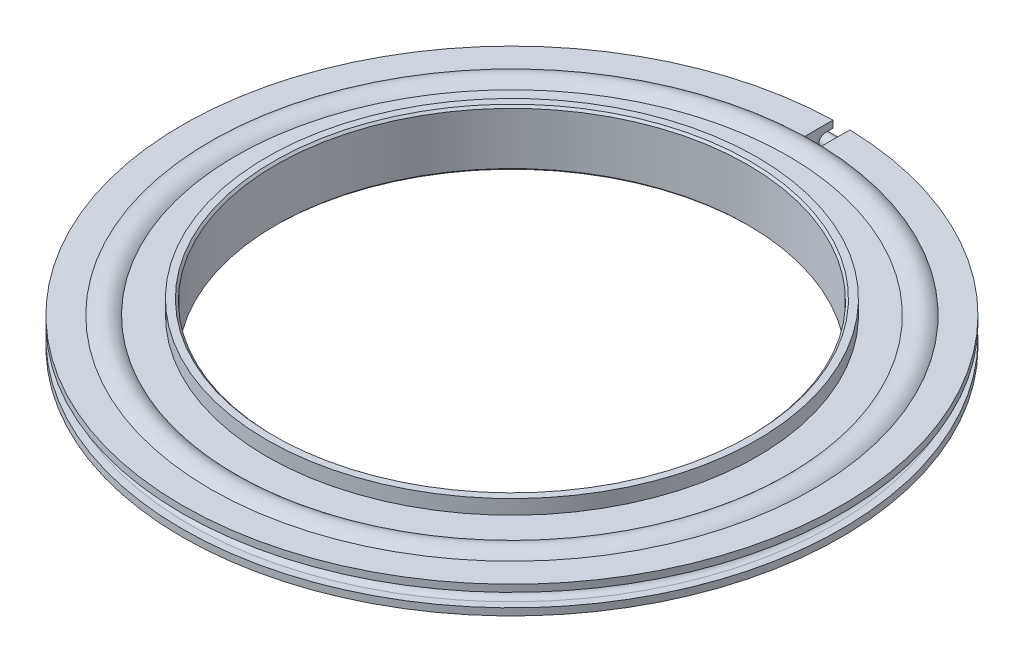
from build123d import *

# Parameters (mm, degrees)
SKETCH5_R                = 2.65
CUT_THICKEN1_START       = -1.2
CUT_THICKEN1_2_OUTLINE_W = 3.9
CUT_THICKEN1_2_OUTLINE_H = 7
CUT_THICKEN1_2_DEPTH     = 2.4
SKETCH12_R               = 0.9
SKETCH12_R_2             = 0.7
REVOLVE4_ANGLE           = 28


with BuildPart() as part:
    # Sketch5 → Revolve2 (revolve)
    with BuildSketch(Plane(origin=(0, 0, 0), x_dir=(-1, 0, 0), z_dir=(0, 0, -1)), mode=Mode.PRIVATE) as revolve2_sk:
        with Locations((-41, 0)):
            Circle(SKETCH5_R)
    revolve(revolve2_sk.sketch.rotate(Axis((0, -2.65, 0), (0, 1, 0)), 270), axis=Axis((0, -2.65, 0), (0, 1, 0)))


with BuildPart() as body_2:
    # Sketch7 → Revolve3 (revolve)
    with BuildSketch(Plane.XY, mode=Mode.PRIVATE) as revolve3_sk:
        with BuildLine():
            Line((34.8, 4), (33.8, 4))
            Line((33.8, 4), (33.5, 3.7))
            Line((33.5, 3.7), (33.5, -3.7))
            Line((33.5, -3.7), (33.8, -4))
            Line((33.8, -4), (34.8, -4))
            Line((34.8, -4), (34.8, -1.95))
            Line((34.8, -1.95), (39.205564156, -1.95))
            ThreePointArc((39.205564156, -1.95), (38.35, 0), (39.205564156, 1.95))
            Line((39.205564156, 1.95), (34.8, 1.95))
            Line((34.8, 1.95), (34.8, 4))
        make_face()
    revolve(revolve3_sk.sketch.rotate(Axis((0, 4, 0), (0, -1, 0)), 270), axis=Axis((0, 4, 0), (0, -1, 0)))


with BuildPart() as body_3:
    # Cut-Thicken1: read off the stored shape, not the designer's step
    # Cut-Thicken1 outline → Cut-Thicken1 (revolve)
    with BuildSketch(Plane.XY):
        with BuildLine():
            Line((42.794435844, -1.95), (46.8, -1.95))
            Line((46.8, -1.95), (46.8, -0.95))
            Line((46.8, -0.95), (45.75, -0.95))
            ThreePointArc((45.75, -0.95), (44.8, 0), (45.75, 0.95))
            Line((45.75, 0.95), (46.8, 0.95))
            Line((46.8, 0.95), (46.8, 1.95))
            Line((46.8, 1.95), (42.794435844, 1.95))
            ThreePointArc((42.794435844, 1.95), (43.65, 0), (42.794435844, -1.95))
        make_face()
    revolve(axis=Axis((0, 0, 0), (0, 1, 0)))

    # Cut-Thicken1 2 outline → Cut-Thicken1 2 (cut)
    with BuildSketch(Plane.YZ.offset(CUT_THICKEN1_START)):
        with Locations((0, -44.5)):
            Rectangle(CUT_THICKEN1_2_OUTLINE_W, CUT_THICKEN1_2_OUTLINE_H)
    extrude(amount=CUT_THICKEN1_2_DEPTH, mode=Mode.SUBTRACT)


with BuildPart() as body_4:
    # Sketch12 → Revolve4 (revolve)
    with BuildSketch(Plane(origin=(0, 0, 0), x_dir=(0.2419218955996686, 0, 0.9702957262759964), z_dir=(-0.9702957262759964, 0, 0.2419218955996686))):
        with Locations((-45.75, 0)):
            Circle(SKETCH12_R)
        with Locations((-45.75, 0)):
            Circle(SKETCH12_R_2, mode=Mode.SUBTRACT)
    revolve(axis=Axis((0, -0.9, 0), (0, -1, 0)), revolution_arc=REVOLVE4_ANGLE)


solid = Compound([part.part, body_2.part, body_3.part, body_4.part])
